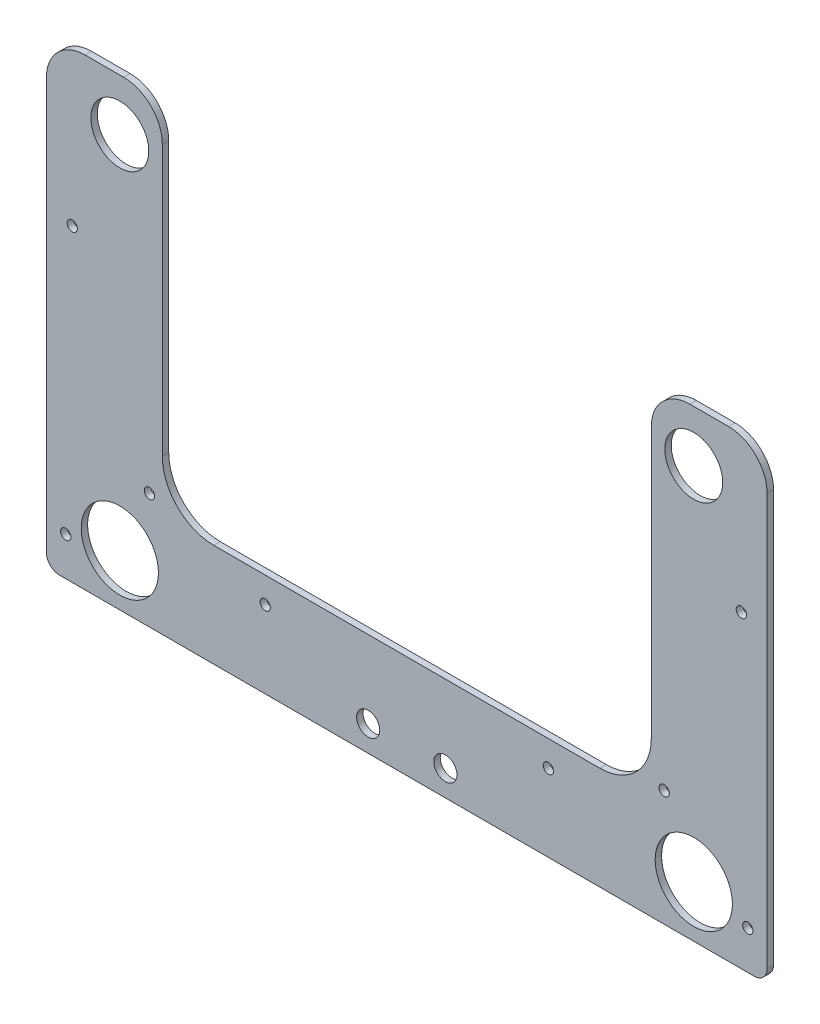
from build123d import *

# Parameters (mm, degrees)
SKETCH1_R           = 14.2875
SKETCH1_R_2         = 19.05
SKETCH1_R_3         = 2.54
SKETCH1_R_4         = 5.715
BOSS_EXTRUDE3_DEPTH = 3.175
SKETCH2_W           = 355.6
SKETCH2_H           = 19.05
CUT_EXTRUDE1_DEPTH  = 290.621961572
FILLET1_R           = 19.05


with BuildPart() as part:
    # Sketch1 → Boss-Extrude3 (new body)
    with BuildSketch(Plane.XY):
        with BuildLine():
            Line((120.65, -152.4), (120.65, -6.35))
            Line((120.65, -6.35), (120.65, 6.35))
            ThreePointArc((120.65, 6.35), (124.369743879, 15.330256121), (133.35, 19.05))
            Line((133.35, 19.05), (165.1, 19.05))
            ThreePointArc((165.1, 19.05), (174.080256121, 15.330256121), (177.8, 6.35))
            Line((177.8, 6.35), (177.8, -6.35))
            Line((177.8, -6.35), (177.8, -222.25))
            ThreePointArc((177.8, -222.25), (175.940128061, -226.740128061), (171.45, -228.6))
            Line((171.45, -228.6), (12.7, -228.6))
            Line((12.7, -228.6), (-12.7, -228.6))
            Line((-12.7, -228.6), (-171.45, -228.6))
            ThreePointArc((-171.45, -228.6), (-175.940128061, -226.740128061), (-177.8, -222.25))
            Line((-177.8, -222.25), (-177.8, -6.35))
            Line((-177.8, -6.35), (-177.8, 6.35))
            ThreePointArc((-177.8, 6.35), (-174.080256121, 15.330256121), (-165.1, 19.05))
            Line((-165.1, 19.05), (-133.35, 19.05))
            ThreePointArc((-133.35, 19.05), (-124.369743879, 15.330256121), (-120.65, 6.35))
            Line((-120.65, 6.35), (-120.65, -6.35))
            Line((-120.65, -6.35), (-120.65, -152.4))
            ThreePointArc((-120.65, -152.4), (-113.210512242, -170.360512242), (-95.25, -177.8))
            Line((-95.25, -177.8), (-12.7, -177.8))
            Line((-12.7, -177.8), (12.7, -177.8))
            Line((12.7, -177.8), (95.25, -177.8))
            ThreePointArc((95.25, -177.8), (113.210512242, -170.360512242), (120.65, -152.4))
        make_face()
        with Locations((141.605, -25.4)):
            Circle(SKETCH1_R, mode=Mode.SUBTRACT)
        with Locations((-141.605, -25.4)):
            Circle(SKETCH1_R, mode=Mode.SUBTRACT)
        with Locations((-141.605, -203.2)):
            Circle(SKETCH1_R_2, mode=Mode.SUBTRACT)
        with Locations((141.605, -203.2)):
            Circle(SKETCH1_R_2, mode=Mode.SUBTRACT)
        with Locations((-69.85, -190.5)):
            Circle(SKETCH1_R_3, mode=Mode.SUBTRACT)
        with Locations((69.85, -190.5)):
            Circle(SKETCH1_R_3, mode=Mode.SUBTRACT)
        with Locations((-19.05, -215.9)):
            Circle(SKETCH1_R_4, mode=Mode.SUBTRACT)
        with Locations((-149.225, 6.35)):
            Circle(SKETCH1_R_3, mode=Mode.SUBTRACT)
        with Locations((149.225, 6.35)):
            Circle(SKETCH1_R_3, mode=Mode.SUBTRACT)
        with Locations((-168.275, -209.55)):
            Circle(SKETCH1_R_3, mode=Mode.SUBTRACT)
        with Locations((168.275, -209.55)):
            Circle(SKETCH1_R_3, mode=Mode.SUBTRACT)
        with Locations((-165.1, -76.2)):
            Circle(SKETCH1_R_3, mode=Mode.SUBTRACT)
        with Locations((165.1, -76.2)):
            Circle(SKETCH1_R_3, mode=Mode.SUBTRACT)
        with Locations((-127, -171.45)):
            Circle(SKETCH1_R_3, mode=Mode.SUBTRACT)
        with Locations((127, -171.45)):
            Circle(SKETCH1_R_3, mode=Mode.SUBTRACT)
        with Locations((19.05, -215.9)):
            Circle(SKETCH1_R_4, mode=Mode.SUBTRACT)
    extrude(amount=BOSS_EXTRUDE3_DEPTH)

    # Sketch2 → Cut-Extrude1 (cut, through all)
    with BuildSketch(Plane.XY.offset(3.175)):
        with Locations((0, 9.525)):
            Rectangle(SKETCH2_W, SKETCH2_H)
    extrude(amount=-CUT_EXTRUDE1_DEPTH, mode=Mode.SUBTRACT)

    # Fillet1
    fillet1_edges = [part.edges().sort_by_distance(p)[0] for p in [
        (177.8, 0, 1.5875),
        (120.65, 0, 1.5875),
        (-120.65, 0, 1.5875),
        (-177.8, 0, 1.5875),
    ]]
    fillet(fillet1_edges, radius=FILLET1_R)


solid = part.part
